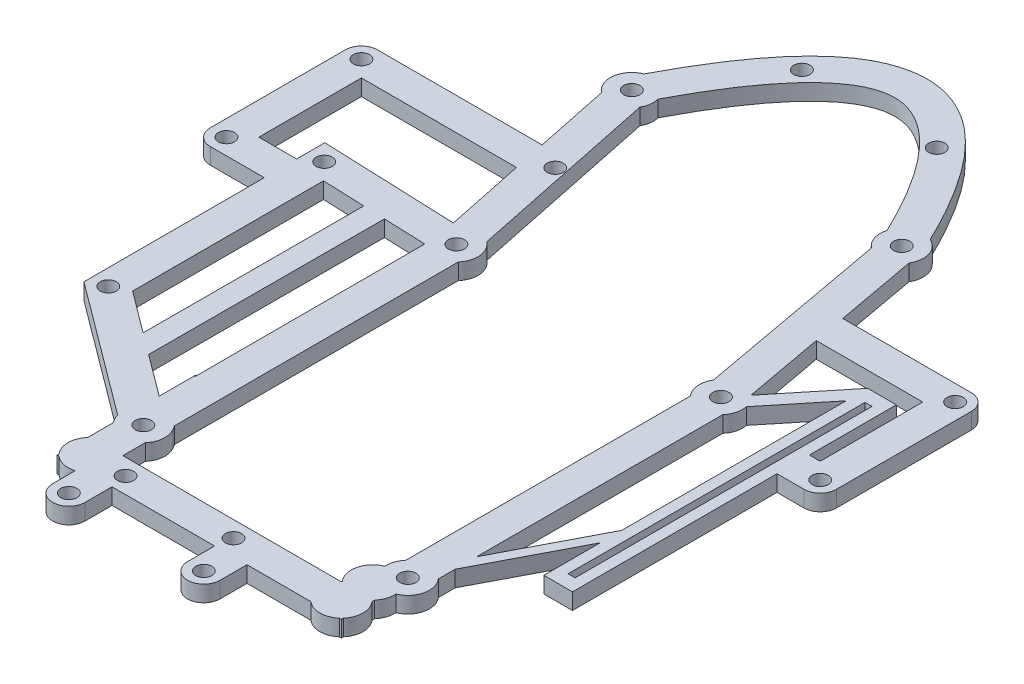
from build123d import *

# Parameters (mm, degrees)
SKETCH_1_W           = 80
SKETCH_1_H           = 120
SKETCH_1_R           = 1.5
EXTRUDE_1_DEPTH      = 3
SKETCH_2_W           = 10
SKETCH_2_H           = 60
SKETCH_2_W_2         = 1.3
SKETCH_2_H_2         = 55
EXTRUDE_2_DEPTH      = 3
CUT_EXTRUDE_1_DEPTH  = 126.435242257
EXTRUDE_4_DEPTH      = 3
SKETCH_23_R          = 1.5
EXTRUDE_9_DEPTH      = 3
SKETCH_25_R          = 1.5
CUT_EXTRUDE_8_DEPTH  = 124.421392121
SKETCH_26_R          = 1.5
CUT_EXTRUDE_9_DEPTH  = 124.421392121
EXTRUDE_10_DEPTH     = 3
SKETCH_28_R          = 1.5
CUT_EXTRUDE_10_DEPTH = 124.421392121
SKETCH_29_R          = 1.5
EXTRUDE_11_DEPTH     = 3
SKETCH_30_R          = 3
SKETCH_30_R_2        = 1.5
EXTRUDE_12_DEPTH     = 3


with BuildPart() as part:
    # 草图1 → 凸台-拉伸1 (new body)
    # profile 1 of 5: a face of its own
    with BuildSketch(Plane(origin=(0, 0, 0), x_dir=(1, 0, 0), z_dir=(0, 1, 0))):
        with Locations((0, -55)):
            Rectangle(SKETCH_1_W, SKETCH_1_H)
        with Locations(Location((32.5, -99, 0), (0, 0, 270))):
            Circle(SKETCH_1_R, mode=Mode.SUBTRACT)
        with Locations(Location((32.5, -41, 0), (0, 0, 270))):
            Circle(SKETCH_1_R, mode=Mode.SUBTRACT)
        with Locations(Location((-16.5, -99, 0), (0, 0, 270))):
            Circle(SKETCH_1_R, mode=Mode.SUBTRACT)
        with Locations(Location((-16.5, -41, 0), (0, 0, 270))):
            Circle(SKETCH_1_R, mode=Mode.SUBTRACT)
        with Locations((30, -91.2)):
            Circle(SKETCH_1_R, mode=Mode.SUBTRACT)
        with Locations((30, -108.8)):
            Circle(SKETCH_1_R, mode=Mode.SUBTRACT)
        with Locations((-30, -108.8)):
            Circle(SKETCH_1_R, mode=Mode.SUBTRACT)
        with Locations((-30, -91.2)):
            Circle(SKETCH_1_R, mode=Mode.SUBTRACT)
        with Locations(Location((25, 0, 0), (0, 0, 270))):
            Circle(SKETCH_1_R, mode=Mode.SUBTRACT)
        with Locations(Location((-25, 0, 0), (0, 0, 270))):
            Circle(SKETCH_1_R, mode=Mode.SUBTRACT)
    # profile 2 of 5: a face of its own
    with BuildSketch(Plane(origin=(0, 0, 0), x_dir=(1, 0, 0), z_dir=(0, 1, 0))):
        with Locations((-30, -108.8)):
            Circle(SKETCH_1_R)
    # profile 3 of 5: a face of its own
    with BuildSketch(Plane(origin=(0, 0, 0), x_dir=(1, 0, 0), z_dir=(0, 1, 0))):
        with Locations((-30, -91.2)):
            Circle(SKETCH_1_R)
    # profile 4 of 5: a face of its own
    with BuildSketch(Plane(origin=(0, 0, 0), x_dir=(1, 0, 0), z_dir=(0, 1, 0))):
        with Locations((30, -91.2)):
            Circle(SKETCH_1_R)
    # profile 5 of 5: a face of its own
    with BuildSketch(Plane(origin=(0, 0, 0), x_dir=(1, 0, 0), z_dir=(0, 1, 0))):
        with Locations((30, -108.8)):
            Circle(SKETCH_1_R)
    extrude(amount=EXTRUDE_1_DEPTH)

    # 草图2 → 凸台-拉伸2 (add)
    with BuildSketch(Plane(origin=(0, 3, 0), x_dir=(1, 0, 0), z_dir=(0, 1, 0))):
        with Locations((45, -56)):
            Rectangle(SKETCH_2_W, SKETCH_2_H)
        with Locations((47.35, -56)):
            Rectangle(SKETCH_2_W_2, SKETCH_2_H_2, mode=Mode.SUBTRACT)
    extrude(amount=-EXTRUDE_2_DEPTH)

    # 草图6 → 切除-拉伸1 (cut, through all)
    with BuildSketch(Plane(origin=(0, 3, 0), x_dir=(1, 0, 0), z_dir=(0, 1, 0))):
        with BuildLine():
            Line((-19.974624641, -39.01833817), (-27.400447224, -3.199664533))
            ThreePointArc((-27.400447224, -3.199664533), (-25.812001802, 3.916714576), (-21.525375359, -1.98166183))
            Line((-21.525375359, -1.98166183), (-14.099552776, -37.800335467))
            ThreePointArc((-14.099552776, -37.800335467), (-12.520875831, -40.591869081), (-13.5, -43.645751311))
            Line((-13.5, -43.645751311), (-13.5, -96.223972971))
            ThreePointArc((-13.5, -96.223972971), (-13.237813818, -96.609867416), (-13.022342803, -97.023664901))
            ThreePointArc((-13.022342803, -97.023664901), (-12.521189702, -99.411179542), (-13.5, -101.645751311))
            Line((-13.5, -101.645751311), (-13.5, -105.8))
            Line((-13.5, -105.8), (27, -105.8))
            Line((27, -105.8), (27, -105.632123229))
            ThreePointArc((27, -105.632123229), (26.108183077, -102.062380016), (28.509428025, -99.274472783))
            ThreePointArc((28.509428025, -99.274472783), (28.711999033, -97.715068611), (29.5, -96.354248689))
            Line((29.5, -96.354248689), (29.5, -43.645751311))
            ThreePointArc((29.5, -43.645751311), (28.516356033, -41.36135958), (29.072888672, -38.937257179))
            Line((29.072888672, -38.937257179), (22.525046888, -3.142388756))
            ThreePointArc((22.525046888, -3.142388756), (24.280236044, 3.934709627), (28.427111328, -2.062742821))
            Line((28.427111328, -2.062742821), (34.974953112, -37.857611244))
            ThreePointArc((34.974953112, -37.857611244), (34.999517331, -37.877114617), (35.023927863, -37.896810005))
            Line((35.023927863, -37.896810005), (44.7, -26))
            Line((44.7, -26), (40, -26))
            Line((40, -26), (40, 5))
            Line((40, 5), (-40, 5))
            Line((-40, 5), (-40, -115))
            Line((-40, -115), (40, -115))
            Line((40, -115), (40, -86))
            Line((40, -86), (44.7, -86))
            Line((44.7, -86), (44.7, -75.572007087))
            Line((44.7, -75.572007087), (35.5, -93.239018136))
            Line((35.5, -93.239018136), (35.5, -96.354248689))
            ThreePointArc((35.5, -96.354248689), (36.391816923, -99.923991902), (33.990571975, -102.711899135))
            ThreePointArc((33.990571975, -102.711899135), (33.788000967, -104.271303307), (33, -105.632123229))
            Line((33, -105.632123229), (33, -106.154248689))
            ThreePointArc((33, -106.154248689), (34, -108.8), (33, -111.445751311))
            Line((33, -111.445751311), (33, -111.8))
            Line((33, -111.8), (32.645751311, -111.8))
            ThreePointArc((32.645751311, -111.8), (30, -112.8), (27.354248689, -111.8))
            Line((27.354248689, -111.8), (-14.026115719, -111.8))
            ThreePointArc((-14.026115719, -111.8), (-16.67186703, -112.8), (-19.317618341, -111.8))
            Line((-19.317618341, -111.8), (-19.67186703, -111.8))
            Line((-19.67186703, -111.8), (-19.67186703, -111.445751311))
            ThreePointArc((-19.67186703, -111.445751311), (-20.67186703, -108.8), (-19.67186703, -106.154248689))
            Line((-19.67186703, -106.154248689), (-19.67186703, -101.437059611))
            ThreePointArc((-19.67186703, -101.437059611), (-19.934053212, -101.051165166), (-20.149524226, -100.63736768))
            ThreePointArc((-20.149524226, -100.63736768), (-20.650677327, -98.24985304), (-19.67186703, -96.015281271))
            Line((-19.67186703, -96.015281271), (-19.67186703, -86.110347101))
            Line((-19.67186703, -86.110347101), (-19.5, -86.44931452))
            Line((-19.5, -86.44931452), (-19.5, -43.645751311))
            ThreePointArc((-19.5, -43.645751311), (-20.479124169, -41.408130919), (-19.974624641, -39.01833817))
        make_face()
        with BuildLine():
            Line((35.5, -43.645751311), (35.5, -89.239018136))
            Line((35.5, -89.239018136), (44.7, -71.572007087))
            Line((44.7, -71.572007087), (44.7, -30))
            Line((44.7, -30), (36.416113845, -40.185105928))
            ThreePointArc((36.416113845, -40.185105928), (36.366804145, -42.023633578), (35.5, -43.645751311))
        make_face()
    extrude(amount=-CUT_EXTRUDE_1_DEPTH, mode=Mode.SUBTRACT)

    # 草图8 → 凸台-拉伸4 (add)
    with BuildSketch(Plane(origin=(0, 3, 0), x_dir=(1, 0, 0), z_dir=(0, 1, 0))):
        with BuildLine():
            ThreePointArc((-26.469356148, 3.720348439), (-23.178611726, 3.561256065), (-21.123486777, 0.986227779))
            add(Edge.make_bspline(
                [(-21.123486777, 0.986227779), (-16.924725692, 8.996120097), (-9.86671034, 17.933754479), (-4.942677087, 21.694051676), (-1.785923347, 22.90925881), (0.57645486, 23.213787767), (2.911633949, 22.91003978), (5.977911566, 21.709273569), (10.693941251, 17.98489718), (17.327148514, 9.094052388), (21.160502683, 1.121722049)],
                knots=[0.023265065, 0.023265065, 0.023265065, 0.1875, 0.3125, 0.40625, 0.46875, 0.53125, 0.59375, 0.6875, 0.8125, 0.976310374, 0.976310374, 0.976310374], degree=2))
            ThreePointArc((21.160502683, 1.121722049), (23.305081101, 3.623154693), (26.599702444, 3.666190406))
            add(Edge.make_bspline(
                [(-26.469356148, 3.720348439), (-22.085843634, 12.112216128), (-14.255799236, 22.08968003), (-8.054298827, 26.905833085), (-3.331397688, 28.753643899), (0.574132073, 29.265919727), (4.471045016, 28.752862928), (9.150112519, 26.890611193), (15.183549173, 22.038537329), (22.589230715, 12.040870083), (26.599702444, 3.666190406)],
                knots=[0.022823183, 0.022823183, 0.022823183, 0.1875, 0.3125, 0.40625, 0.46875, 0.53125, 0.59375, 0.6875, 0.8125, 0.976784227, 0.976784227, 0.976784227], degree=2))
        make_face()
    extrude(amount=-EXTRUDE_4_DEPTH)

    # 草图23 → 凸台-拉伸9 (add)
    with BuildSketch(Plane(origin=(0, 3, 0), x_dir=(1, 0, 0), z_dir=(0, 1, 0))):
        with BuildLine():
            Line((-19.974624641, -39.01833817), (-20.216436517, -37.851951473))
            Line((-20.216436517, -37.851951473), (-45, -36.880047022))
            Line((-45, -36.880047022), (-45, -81.505900851))
            Line((-45, -81.505900851), (-20.522454785, -99.744071795))
            ThreePointArc((-20.522454785, -99.744071795), (-20.571688544, -97.771430335), (-19.67186703, -96.015281271))
            Line((-19.67186703, -96.015281271), (-19.67186703, -92.895453127))
            Line((-19.67186703, -92.895453127), (-39, -78.494099149))
            Line((-39, -78.494099149), (-39, -43.119952978))
            Line((-39, -43.119952978), (-19.5, -43.88465886))
            Line((-19.5, -43.88465886), (-19.5, -43.645751311))
            ThreePointArc((-19.5, -43.645751311), (-20.479124169, -41.408130919), (-19.974624641, -39.01833817))
        make_face()
        with Locations(Location((-42, -80, 0), (0, 0, 270))):
            Circle(SKETCH_23_R, mode=Mode.SUBTRACT)
        with Locations(Location((-42, -40, 0), (0, 0, 270))):
            Circle(SKETCH_23_R, mode=Mode.SUBTRACT)
    extrude(amount=-EXTRUDE_9_DEPTH)

    # 草图25 → 切除-拉伸8 (cut, through all)
    with BuildSketch(Plane(origin=(0, 3, 0), x_dir=(1, 0, 0), z_dir=(0, 1, 0))):
        with Locations(Location((-10, -108.8, 0), (0, 0, 270))):
            Circle(SKETCH_25_R)
        with Locations(Location((10, -108.8, 0), (0, 0, 270))):
            Circle(SKETCH_25_R)
    extrude(amount=-CUT_EXTRUDE_8_DEPTH, mode=Mode.SUBTRACT)

    # 草图26 → 切除-拉伸9 (cut, through all)
    with BuildSketch(Plane(origin=(0, 3, 0), x_dir=(1, 0, 0), z_dir=(0, 1, 0))):
        with Locations(Location((-19.635250756, -19.565556065, 0), (0, 0, 270))):
            Circle(SKETCH_26_R)
    extrude(amount=-CUT_EXTRUDE_9_DEPTH, mode=Mode.SUBTRACT)

    # 草图27 → 凸台-拉伸10 (add)
    with BuildSketch(Plane(origin=(0, 3, 0), x_dir=(1, 0, 0), z_dir=(0, 1, 0))):
        Polygon((-27.250155581, -43.58073119), (-31.249844419, -43.423880648), (-31.332907169, -84.206834984), (-27.33895986, -87.182717292), align=None)
    extrude(amount=-EXTRUDE_10_DEPTH)

    # 草图28 → 切除-拉伸10 (cut, through all)
    with BuildSketch(Plane(origin=(0, 3, 0), x_dir=(1, 0, 0), z_dir=(0, 1, 0))):
        with Locations(Location((-12.5, 19, 0), (0, 0, 270))):
            Circle(SKETCH_28_R)
        with Locations(Location((12.5, 19, 0), (0, 0, 270))):
            Circle(SKETCH_28_R)
    extrude(amount=-CUT_EXTRUDE_10_DEPTH, mode=Mode.SUBTRACT)

    # 草图29 → 凸台-拉伸11 (add)
    # profile 1 of 2: a face of its own
    with BuildSketch(Plane(origin=(0, 3, 0), x_dir=(1, 0, 0), z_dir=(0, 1, 0))):
        with BuildLine():
            Line((-45, -48.10369719), (-45, -42.10369719))
            Line((-45, -42.10369719), (-52, -42.10369719))
            Line((-52, -42.10369719), (-52, -23.10369719))
            Line((-52, -23.10369719), (-23.274001429, -23.10369719))
            Line((-23.274001429, -23.10369719), (-24.517903868, -17.10369719))
            Line((-24.517903868, -17.10369719), (-55, -17.10369719))
            ThreePointArc((-55, -17.10369719), (-57.121320344, -17.982376846), (-58, -20.10369719))
            Line((-58, -20.10369719), (-58, -45.10369719))
            ThreePointArc((-58, -45.10369719), (-57.121320344, -47.225017534), (-55, -48.10369719))
            Line((-55, -48.10369719), (-45, -48.10369719))
        make_face()
        with Locations(Location((-55, -45.10369719, 0), (0, 0, 270))):
            Circle(SKETCH_29_R, mode=Mode.SUBTRACT)
        with Locations(Location((-55, -20.10369719, 0), (0, 0, 270))):
            Circle(SKETCH_29_R, mode=Mode.SUBTRACT)
    # profile 2 of 2: a face of its own
    with BuildSketch(Plane(origin=(0, 3, 0), x_dir=(1, 0, 0), z_dir=(0, 1, 0))):
        with BuildLine():
            Line((52, -42.10369719), (50, -42.10369719))
            Line((50, -42.10369719), (50, -48.10369719))
            Line((50, -48.10369719), (55, -48.10369719))
            ThreePointArc((55, -48.10369719), (57.121320344, -47.225017534), (58, -45.10369719))
            Line((58, -45.10369719), (58, -20.10369719))
            ThreePointArc((58, -20.10369719), (57.121320344, -17.982376846), (55, -17.10369719))
            Line((55, -17.10369719), (31.17850542, -17.10369719))
            Line((31.17850542, -17.10369719), (32.276066395, -23.10369719))
            Line((32.276066395, -23.10369719), (52, -23.10369719))
            Line((52, -23.10369719), (52, -42.10369719))
        make_face()
        with Locations(Location((55, -45.10369719, 0), (0, 0, 270))):
            Circle(SKETCH_29_R, mode=Mode.SUBTRACT)
        with Locations(Location((55, -20.10369719, 0), (0, 0, 270))):
            Circle(SKETCH_29_R, mode=Mode.SUBTRACT)
    extrude(amount=-EXTRUDE_11_DEPTH)

    # 草图30 → 凸台-拉伸12 (add)
    # profile 1 of 4: a face of its own
    with BuildSketch(Plane(origin=(0, 3, 0), x_dir=(1, 0, 0), z_dir=(0, 1, 0))):
        with BuildLine():
            ThreePointArc((-15.5, -116.8), (-12.5, -113.8), (-9.5, -116.8))
            Line((-9.5, -116.8), (-9.5, -111.8))
            Line((-9.5, -111.8), (-14.026115719, -111.8))
            ThreePointArc((-14.026115719, -111.8), (-14.719048912, -112.290916986), (-15.5, -112.62449051))
            Line((-15.5, -112.62449051), (-15.5, -116.8))
        make_face()
    # profile 2 of 4: a face of its own
    with BuildSketch(Plane(origin=(0, 3, 0), x_dir=(1, 0, 0), z_dir=(0, 1, 0))):
        with Locations((-12.5, -116.8)):
            Circle(SKETCH_30_R)
        with Locations(Location((-12.5, -116.8, 0), (0, 0, 270))):
            Circle(SKETCH_30_R_2, mode=Mode.SUBTRACT)
    # profile 3 of 4: a face of its own
    with BuildSketch(Plane(origin=(0, 3, 0), x_dir=(1, 0, 0), z_dir=(0, 1, 0))):
        with BuildLine():
            Line((15.5, -111.8), (9.5, -111.8))
            Line((9.5, -111.8), (9.5, -116.8))
            ThreePointArc((9.5, -116.8), (12.5, -113.8), (15.5, -116.8))
            Line((15.5, -116.8), (15.5, -111.8))
        make_face()
    # profile 4 of 4: a face of its own
    with BuildSketch(Plane(origin=(0, 3, 0), x_dir=(1, 0, 0), z_dir=(0, 1, 0))):
        with Locations((12.5, -116.8)):
            Circle(SKETCH_30_R)
        with Locations(Location((12.5, -116.8, 0), (0, 0, 270))):
            Circle(SKETCH_30_R_2, mode=Mode.SUBTRACT)
    extrude(amount=-EXTRUDE_12_DEPTH)


solid = part.part
